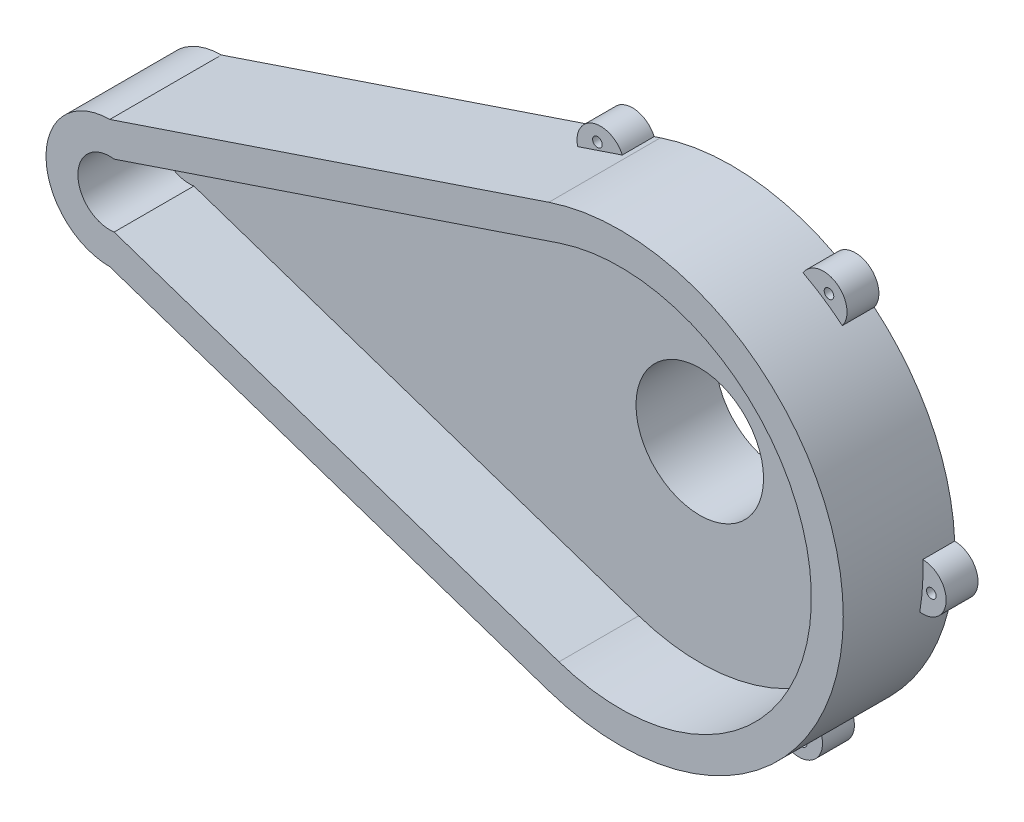
from build123d import *

# Parameters (mm, degrees)
BOSS_EXTRUDE1_DEPTH = 35
CUT_EXTRUDE1_DEPTH  = 25
SKETCH9_R           = 70
SKETCH6_R           = 45
SKETCH11_R          = 20
CUT_EXTRUDE4_DEPTH  = 120
SKETCH12_R          = 9.545
CUT_EXTRUDE5_DEPTH  = 5
BOSS_EXTRUDE4_START = -10
SKETCH13_R          = 1.5
BOSS_EXTRUDE4_DEPTH = 10
CIRPATTERN1_COUNT   = 6
SKETCH14_R          = 3.1
CUT_EXTRUDE6_DEPTH  = 65
CIRPATTERN2_COUNT   = 5
SKETCH15_R          = 45
BOSS_EXTRUDE5_DEPTH = 1
SKETCH16_R          = 2.5
CUT_EXTRUDE7_DEPTH  = 10


with BuildPart() as part:
    # Sketch1 → Boss-Extrude1 (new body)
    with BuildSketch(Plane.XY):
        with BuildLine():
            Line((-100.266242717, 20), (37.401516769, 66.342075892))
            ThreePointArc((37.401516769, 66.342075892), (129.733757283, 0), (37.401516769, -66.342075892))
            Line((37.401516769, -66.342075892), (-100.266242717, -20))
            ThreePointArc((-100.266242717, -20), (-120.266242717, 0), (-100.266242717, 20))
        make_face()
    extrude(amount=-BOSS_EXTRUDE1_DEPTH)

    # Sketch2 → Cut-Extrude1 (cut)
    with BuildSketch(Plane.XY):
        with BuildLine():
            Line((40.591836843, 56.864636479), (-98.904861101, 9.906898611))
            ThreePointArc((-98.904861101, 9.906898611), (-110.266242717, 0), (-98.904861101, -9.906898611))
            Line((-98.904861101, -9.906898611), (40.591836843, -56.864636479))
            ThreePointArc((40.591836843, -56.864636479), (119.733757283, 0), (40.591836843, 56.864636479))
        make_face()
    extrude(amount=-CUT_EXTRUDE1_DEPTH, mode=Mode.SUBTRACT)

    # Sketch9 → Loft2 section 0
    with BuildSketch(Plane(origin=(0, 0, -35), x_dir=(-1, 0, 0), z_dir=(0, 0, -1))):
        with Locations((-59.733757283, 0)):
            Circle(SKETCH9_R)
    # Sketch6 → Loft2 section 1
    with BuildSketch(Plane.XY.offset(-50)):
        with Locations((59.733757283, 0)):
            Circle(SKETCH6_R)
    loft()

    # Sketch11 → Cut-Extrude4 (cut)
    with BuildSketch(Plane(origin=(0, 0, -50), x_dir=(-1, 0, 0), z_dir=(0, 0, -1))):
        with Locations((-59.733757283, 0)):
            Circle(SKETCH11_R)
    extrude(amount=-CUT_EXTRUDE4_DEPTH, mode=Mode.SUBTRACT)

    # Sketch12 → Cut-Extrude5 (cut)
    with BuildSketch(Plane(origin=(0, 0, -35), x_dir=(-1, 0, 0), z_dir=(0, 0, -1))):
        with Locations((100.266242717, 0)):
            Circle(SKETCH12_R)
    extrude(amount=-CUT_EXTRUDE5_DEPTH, mode=Mode.SUBTRACT)

    # Sketch13 → Boss-Extrude4 (add)
    with BuildSketch(Plane(origin=(0, 0, -35), x_dir=(-1, 0, 0), z_dir=(0, 0, -1)).offset(BOSS_EXTRUDE4_START)):
        with BuildLine():
            ThreePointArc((-92.1369101, 62.048655808), (-102.604900484, 64.442416781), (-104.442007118, 53.862532401))
            ThreePointArc((-104.442007118, 53.862532401), (-98.506109015, 58.281255487), (-92.1369101, 62.048655808))
        make_face()
        with Locations((-100.254609037, 60.4530095)):
            Circle(SKETCH13_R, mode=Mode.SUBTRACT)
    boss_extrude4 = extrude(amount=BOSS_EXTRUDE4_DEPTH)

    # CirPattern1: Boss-Extrude4 ×6 about axis
    cirpattern1_axis = Axis((59.733757283, 0, -35), (0, 0, 1))
    for i in range(1, CIRPATTERN1_COUNT):
        add(boss_extrude4.rotate(cirpattern1_axis, i * 360 / CIRPATTERN1_COUNT))

    # Sketch14 → Cut-Extrude6 (cut)
    with BuildSketch(Plane(origin=(0, 0, -35), x_dir=(-1, 0, 0), z_dir=(0, 0, -1))):
        with Locations((-60, 36)):
            Circle(SKETCH14_R)
    cut_extrude6 = extrude(amount=CUT_EXTRUDE6_DEPTH, mode=Mode.SUBTRACT)

    # CirPattern2: Cut-Extrude6 ×5 about axis
    cirpattern2_axis = Axis((59.733757283, 0, -50), (0, 0, 1))
    for i in range(1, CIRPATTERN2_COUNT):
        add(cut_extrude6.rotate(cirpattern2_axis, i * 360 / CIRPATTERN2_COUNT), mode=Mode.SUBTRACT)

    # Sketch15 → Boss-Extrude5 (add)
    with BuildSketch(Plane(origin=(0, 0, -50), x_dir=(-1, 0, 0), z_dir=(0, 0, -1))):
        with Locations((-59.733757283, 0)):
            Circle(SKETCH15_R)
        with BuildLine():
            ThreePointArc((-96.493314967, 6.392553924), (-89.192154705, 9.331327054), (-93.469730769, 15.937814146))
            ThreePointArc((-93.469730769, 15.937814146), (-95.012371471, 16.996874554), (-95.004096917, 18.868045528))
            ThreePointArc((-95.004096917, 18.868045528), (-83.483845521, 32.185917863), (-67.360798587, 39.266120778))
            ThreePointArc((-67.360798587, 39.266120778), (-65.570411406, 38.722187855), (-65.013405248, 36.935824672))
            ThreePointArc((-65.013405248, 36.935824672), (-59.962283313, 30.900139467), (-55.000984413, 37.009872842))
            ThreePointArc((-55.000984413, 37.009872842), (-54.470460303, 38.804278998), (-52.688313978, 39.37463306))
            ThreePointArc((-52.688313978, 39.37463306), (-36.46231125, 32.533671781), (-24.746342627, 19.387645956))
            ThreePointArc((-24.746342627, 19.387645956), (-24.710393513, 17.516802044), (-26.23720149, 16.435041126))
            ThreePointArc((-26.23720149, 16.435041126), (-30.416596715, 9.766009394), (-23.072769302, 6.935545189))
            ThreePointArc((-23.072769302, 6.935545189), (-21.202246669, 6.985488775), (-20.10909422, 5.466815997))
            ThreePointArc((-20.10909422, 5.466815997), (-21.601124429, -12.079002923), (-30.483304543, -27.283896615))
            ThreePointArc((-30.483304543, -27.283896615), (-32.251473949, -27.896208818), (-33.752099331, -26.778410649))
            ThreePointArc((-33.752099331, -26.778410649), (-41.386229568, -24.864413727), (-41.80879352, -32.723470184))
            ThreePointArc((-41.80879352, -32.723470184), (-41.183271065, -34.487009507), (-42.289812022, -35.995954964))
            ThreePointArc((-42.289812022, -35.995954964), (-59.437940131, -39.998906138), (-76.643397959, -36.25002141))
            ThreePointArc((-76.643397959, -36.25002141), (-77.772135864, -34.757607251), (-77.172765378, -32.985009072))
            ThreePointArc((-77.172765378, -32.985009072), (-77.711522113, -25.133062188), (-85.316508411, -27.159761993))
            ThreePointArc((-85.316508411, -27.159761993), (-86.800436906, -28.299632821), (-88.577469277, -27.713539622))
            ThreePointArc((-88.577469277, -27.713539622), (-97.683565083, -12.641680582), (-99.434942698, 4.880151291))
            ThreePointArc((-99.434942698, 4.880151291), (-98.364371682, 6.414826169), (-96.493314967, 6.392553924))
        make_face(mode=Mode.SUBTRACT)
    extrude(amount=BOSS_EXTRUDE5_DEPTH)

    # Sketch16 → Cut-Extrude7 (cut)
    with BuildSketch(Plane(origin=(0, 0, -51), x_dir=(-1, 0, 0), z_dir=(0, 0, -1))):
        with Locations((-60, 36)):
            Circle(SKETCH16_R)
        with Locations((-25.57799622, 11.377823669)):
            Circle(SKETCH16_R)
        with Locations((-38.358093318, -28.968118255)):
            Circle(SKETCH16_R)
        with Locations((-80.678631483, -29.28110534)):
            Circle(SKETCH16_R)
        with Locations((-94.054065394, 10.871399926)):
            Circle(SKETCH16_R)
    extrude(amount=-CUT_EXTRUDE7_DEPTH, mode=Mode.SUBTRACT)


solid = part.part
